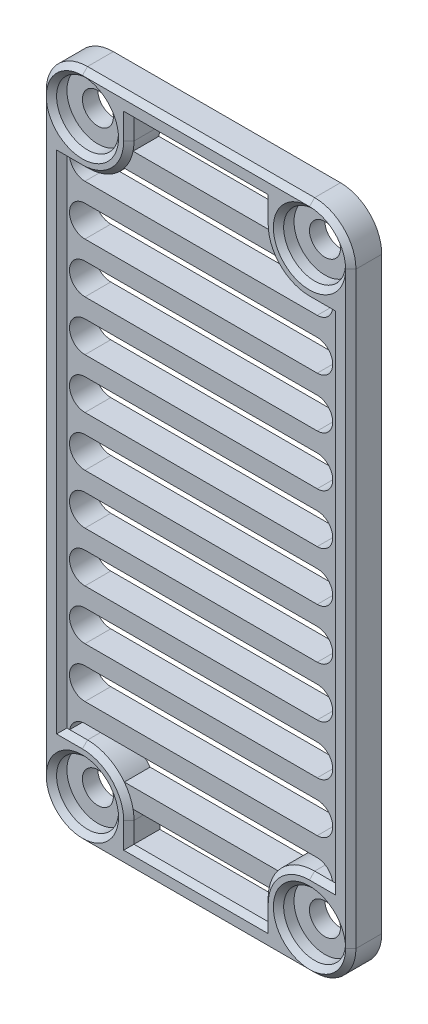
from build123d import *

# Parameters (mm, degrees)
BASE_DEPTH          = 3
SKETCH2_R           = 1.5
CUT_EXTRUDE1_DEPTH  = 36.920050111
CUT_EXTRUDE2_DEPTH  = 36.920050111
SKETCH6_R           = 3
CUT_EXTRUDE3_DEPTH  = 1.5
CHAMFER2_SIZE       = 0.5
BOSS_EXTRUDE1_START = -2.5
BOSS_EXTRUDE1_DEPTH = 2.5
CUT_EXTRUDE4_START  = -2.5
CUT_EXTRUDE4_DEPTH  = 2.5


# Read off the part's stored shape, not the designer's step: Cut-Extrude4
with BuildPart() as part:
    # Sketch1 → Base (new body)
    with BuildSketch(Plane.XY):
        with BuildLine():
            Line((11, -32.5), (-11, -32.5))
            ThreePointArc((-11, -32.5), (-13.828427125, -31.328427125), (-15, -28.5))
            Line((-15, -28.5), (-15, 28.5))
            ThreePointArc((-15, 28.5), (-13.828427125, 31.328427125), (-11, 32.5))
            Line((-11, 32.5), (11, 32.5))
            ThreePointArc((11, 32.5), (13.828427125, 31.328427125), (15, 28.5))
            Line((15, 28.5), (15, -28.5))
            ThreePointArc((15, -28.5), (13.828427125, -31.328427125), (11, -32.5))
        make_face()
    extrude(amount=BASE_DEPTH)

    # Sketch2 → Cut-Extrude1 (cut, through all)
    with BuildSketch(Plane.XY.offset(3)):
        with Locations((-11, 28.5)):
            Circle(SKETCH2_R)
        with Locations((-11, -28.5)):
            Circle(SKETCH2_R)
        with Locations((11, -28.5)):
            Circle(SKETCH2_R)
        with Locations((11, 28.5)):
            Circle(SKETCH2_R)
    extrude(amount=-CUT_EXTRUDE1_DEPTH, mode=Mode.SUBTRACT)

    # Sketch3 → Cut-Extrude2 (cut, through all)
    with BuildSketch(Plane.XY.offset(3)):
        with BuildLine():
            Line((6.5, 28.5), (6.5, 30.5))
            Line((6.5, 30.5), (-6.5, 30.5))
            Line((-6.5, 30.5), (-6.5, 28.5))
            ThreePointArc((-6.5, 28.5), (-7.818019485, 25.318019485), (-11, 24))
            Line((-11, 24), (-13, 24))
            Line((-13, 24), (-13, -24))
            Line((-13, -24), (-11, -24))
            ThreePointArc((-11, -24), (-7.818019485, -25.318019485), (-6.5, -28.5))
            Line((-6.5, -28.5), (-6.5, -30.5))
            Line((-6.5, -30.5), (6.5, -30.5))
            Line((6.5, -30.5), (6.5, -28.5))
            ThreePointArc((6.5, -28.5), (7.818019485, -25.318019485), (11, -24))
            Line((11, -24), (13, -24))
            Line((13, -24), (13, 24))
            Line((13, 24), (11, 24))
            ThreePointArc((11, 24), (7.818019485, 25.318019485), (6.5, 28.5))
        make_face()
    extrude(amount=-CUT_EXTRUDE2_DEPTH, mode=Mode.SUBTRACT)

    # Sketch6 → Cut-Extrude3 (cut)
    with BuildSketch(Plane.XY.offset(3)):
        with Locations((-11, -28.5)):
            Circle(SKETCH6_R)
        with Locations((11, -28.5)):
            Circle(SKETCH6_R)
        with Locations((11, 28.5)):
            Circle(SKETCH6_R)
        with Locations((-11, 28.5)):
            Circle(SKETCH6_R)
    extrude(amount=-CUT_EXTRUDE3_DEPTH, mode=Mode.SUBTRACT)

    # Chamfer2
    chamfer2_edges = [part.edges().sort_by_distance(p)[0] for p in [
        (7.818019485, 25.318019485, 3),
        (13, 0, 3),
        (7.818019485, -25.318019485, 3),
        (-7.818019485, -25.318019485, 3),
        (-13, 0, 3),
        (-7.818019485, 25.318019485, 3),
        (0, -32.5, 3),
        (-13.828427125, -31.328427125, 3),
        (-15, 0, 3),
        (-13.828427125, 31.328427125, 3),
        (0, 32.5, 3),
        (13.828427125, 31.328427125, 3),
        (15, 0, 3),
        (13.828427125, -31.328427125, 3),
        (-14, -28.5, 3),
        (-14, 28.5, 3),
        (8, 28.5, 3),
        (8, -28.5, 3),
        (0, -30.5, 3),
        (0, 30.5, 3),
        (12, 24, 3),
        (6.5, 29.5, 3),
        (-6.5, 29.5, 3),
        (-12, 24, 3),
        (-12, -24, 3),
        (-6.5, -29.5, 3),
        (6.5, -29.5, 3),
        (12, -24, 3),
    ]]
    chamfer(chamfer2_edges, length=CHAMFER2_SIZE - 0.0001)  # a hair under: the kernel refuses the full size

    # Sketch9 → Boss-Extrude1 (add)
    with BuildSketch(Plane(origin=(0, 0, 0), x_dir=(-1, 0, 0), z_dir=(0, 0, -1)).offset(BOSS_EXTRUDE1_START)):
        with BuildLine():
            ThreePointArc((-6.5, -28.5), (-7.818019485, -25.318019485), (-11, -24))
            Line((-11, -24), (-13, -24))
            Line((-13, -24), (-13, 24))
            Line((-13, 24), (-11, 24))
            ThreePointArc((-11, 24), (-7.818019485, 25.318019485), (-6.5, 28.5))
            Line((-6.5, 28.5), (-6.5, 30.5))
            Line((-6.5, 30.5), (6.5, 30.5))
            Line((6.5, 30.5), (6.5, 28.5))
            ThreePointArc((6.5, 28.5), (7.818019485, 25.318019485), (11, 24))
            Line((11, 24), (13, 24))
            Line((13, 24), (13, -24))
            Line((13, -24), (11, -24))
            ThreePointArc((11, -24), (7.818019485, -25.318019485), (6.5, -28.5))
            Line((6.5, -28.5), (6.5, -30.5))
            Line((6.5, -30.5), (-6.5, -30.5))
            Line((-6.5, -30.5), (-6.5, -28.5))
        make_face()
    extrude(amount=BOSS_EXTRUDE1_DEPTH)

    # Cut-Extrude4 outline → Cut-Extrude4 (cut)
    with BuildSketch(Plane(origin=(0, 0, 0), x_dir=(-1, 0, 0), z_dir=(0, 0, -1)).offset(CUT_EXTRUDE4_START)):
        with BuildLine():
            ThreePointArc((11.25, -6.35), (12.75, -4.85), (11.25, -3.35))
            Line((11.25, -3.35), (-11.25, -3.35))
            ThreePointArc((-11.25, -3.35), (-12.75, -4.85), (-11.25, -6.35))
            Line((-11.25, -6.35), (11.25, -6.35))
        make_face()
        with BuildLine():
            ThreePointArc((11.25, 17.9), (12.75, 19.4), (11.25, 20.9))
            Line((11.25, 20.9), (-11.25, 20.9))
            ThreePointArc((-11.25, 20.9), (-12.75, 19.4), (-11.25, 17.9))
            Line((-11.25, 17.9), (11.25, 17.9))
        make_face()
        with BuildLine():
            Line((-11, 24), (-12.729019946, 24))
            ThreePointArc((-12.729019946, 24), (-12.218245837, 23.104356076), (-11.25, 22.75))
            Line((-11.25, 22.75), (11.25, 22.75))
            ThreePointArc((11.25, 22.75), (12.218245837, 23.104356076), (12.729019946, 24))
            Line((12.729019946, 24), (11, 24))
            ThreePointArc((11, 24), (9.015686517, 24.461126395), (7.438048288, 25.75))
            Line((7.438048288, 25.75), (-7.438048288, 25.75))
            ThreePointArc((-7.438048288, 25.75), (-9.015686517, 24.461126395), (-11, 24))
        make_face()
        with BuildLine():
            ThreePointArc((-6.5, 28.5), (-6.522787311, 28.047709671), (-6.590918463, 27.6))
            Line((-6.590918463, 27.6), (6.590918463, 27.6))
            ThreePointArc((6.590918463, 27.6), (6.522787311, 28.047709671), (6.5, 28.5))
            Line((6.5, 28.5), (6.5, 30.5))
            Line((6.5, 30.5), (-6.5, 30.5))
            Line((-6.5, 30.5), (-6.5, 28.5))
        make_face()
        with BuildLine():
            Line((-6.5, -28.5), (-6.5, -30.5))
            Line((-6.5, -30.5), (6.5, -30.5))
            Line((6.5, -30.5), (6.5, -28.5))
            ThreePointArc((6.5, -28.5), (6.522787311, -28.047709671), (6.590918463, -27.6))
            Line((6.590918463, -27.6), (-6.590918463, -27.6))
            ThreePointArc((-6.590918463, -27.6), (-6.522787311, -28.047709671), (-6.5, -28.5))
        make_face()
        with BuildLine():
            Line((-11.25, -1.5), (11.25, -1.5))
            ThreePointArc((11.25, -1.5), (12.75, 0), (11.25, 1.5))
            Line((11.25, 1.5), (-11.25, 1.5))
            ThreePointArc((-11.25, 1.5), (-12.75, 0), (-11.25, -1.5))
        make_face()
        with BuildLine():
            ThreePointArc((11.25, -11.2), (12.75, -9.7), (11.25, -8.2))
            Line((11.25, -8.2), (-11.25, -8.2))
            ThreePointArc((-11.25, -8.2), (-12.75, -9.7), (-11.25, -11.2))
            Line((-11.25, -11.2), (11.25, -11.2))
        make_face()
        with BuildLine():
            ThreePointArc((11.25, -16.05), (12.75, -14.55), (11.25, -13.05))
            Line((11.25, -13.05), (-11.25, -13.05))
            ThreePointArc((-11.25, -13.05), (-12.75, -14.55), (-11.25, -16.05))
            Line((-11.25, -16.05), (11.25, -16.05))
        make_face()
        with BuildLine():
            ThreePointArc((11.25, -20.9), (12.75, -19.4), (11.25, -17.9))
            Line((11.25, -17.9), (-11.25, -17.9))
            ThreePointArc((-11.25, -17.9), (-12.75, -19.4), (-11.25, -20.9))
            Line((-11.25, -20.9), (11.25, -20.9))
        make_face()
        with BuildLine():
            ThreePointArc((12.729019946, -24), (12.218245837, -23.104356076), (11.25, -22.75))
            Line((11.25, -22.75), (-11.25, -22.75))
            ThreePointArc((-11.25, -22.75), (-12.218245837, -23.104356076), (-12.729019946, -24))
            Line((-12.729019946, -24), (-11, -24))
            ThreePointArc((-11, -24), (-9.015686517, -24.461126395), (-7.438048288, -25.75))
            Line((-7.438048288, -25.75), (7.438048288, -25.75))
            ThreePointArc((7.438048288, -25.75), (9.015686517, -24.461126395), (11, -24))
            Line((11, -24), (12.729019946, -24))
        make_face()
        with BuildLine():
            ThreePointArc((11.25, 3.35), (12.75, 4.85), (11.25, 6.35))
            Line((11.25, 6.35), (-11.25, 6.35))
            ThreePointArc((-11.25, 6.35), (-12.75, 4.85), (-11.25, 3.35))
            Line((-11.25, 3.35), (11.25, 3.35))
        make_face()
        with BuildLine():
            ThreePointArc((11.25, 8.2), (12.75, 9.7), (11.25, 11.2))
            Line((11.25, 11.2), (-11.25, 11.2))
            ThreePointArc((-11.25, 11.2), (-12.75, 9.7), (-11.25, 8.2))
            Line((-11.25, 8.2), (11.25, 8.2))
        make_face()
        with BuildLine():
            ThreePointArc((11.25, 13.05), (12.75, 14.55), (11.25, 16.05))
            Line((11.25, 16.05), (-11.25, 16.05))
            ThreePointArc((-11.25, 16.05), (-12.75, 14.55), (-11.25, 13.05))
            Line((-11.25, 13.05), (11.25, 13.05))
        make_face()
    extrude(amount=CUT_EXTRUDE4_DEPTH, mode=Mode.SUBTRACT)


solid = part.part
